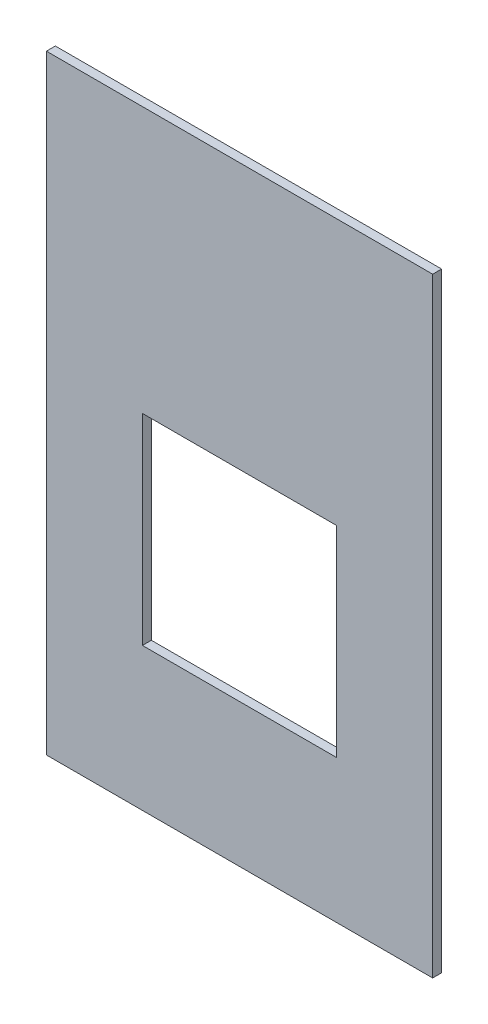
from build123d import *

# Parameters (mm, degrees)
ESQUISSE1_W        = 173
ESQUISSE1_H        = 273
ESQUISSE1_W_2      = 87
ESQUISSE1_H_2      = 90
BOSS_EXTRU_1_DEPTH = 4


with BuildPart() as part:
    # Esquisse1 → Boss.-Extru.1 (new body)
    with BuildSketch(Plane.XY):
        with Locations((86.5, 136.5)):
            Rectangle(ESQUISSE1_W, ESQUISSE1_H)
        with Locations((86.5, 109)):
            Rectangle(ESQUISSE1_W_2, ESQUISSE1_H_2, mode=Mode.SUBTRACT)
    extrude(amount=BOSS_EXTRU_1_DEPTH)


solid = part.part
